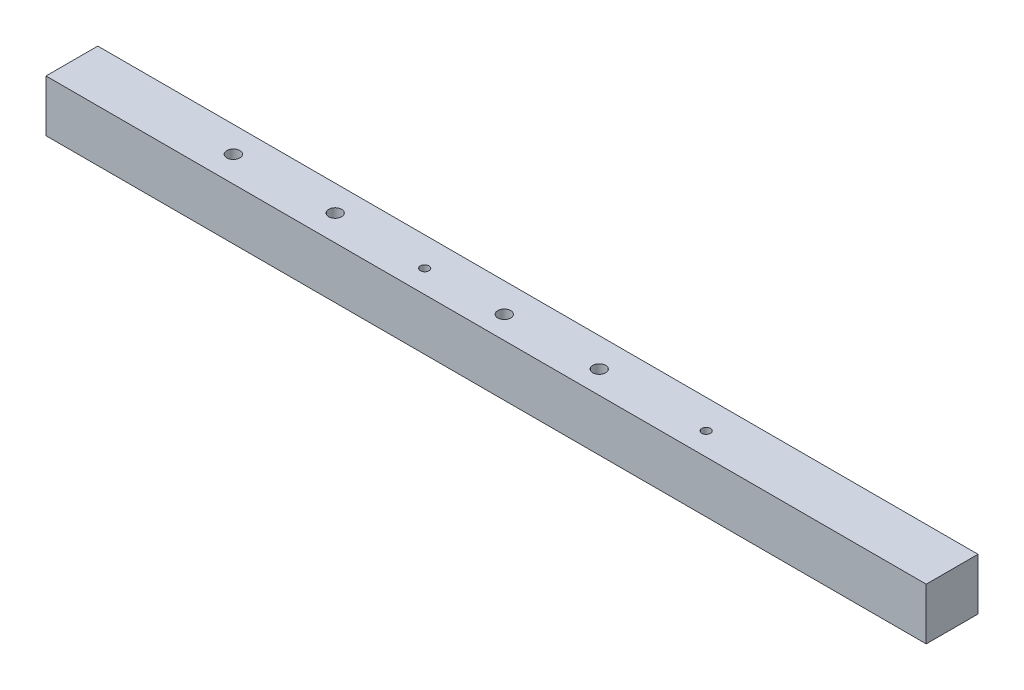
from build123d import *

# Parameters (mm, degrees)
SKETCH1_W           = 647.7
SKETCH1_H           = 38.1
SKETCH1_R           = 4.7625
SKETCH1_R_2         = 3.175
BOSS_EXTRUDE1_DEPTH = 38.1


with BuildPart() as part:
    # Sketch1 → Boss-Extrude1 (new body)
    with BuildSketch(Plane(origin=(0, 0, 0), x_dir=(1, 0, 0), z_dir=(0, 1, 0))):
        with Locations((323.85, 19.05)):
            Rectangle(SKETCH1_W, SKETCH1_H)
        with Locations((118.802175491, 19.05)):
            Circle(SKETCH1_R, mode=Mode.SUBTRACT)
        with Locations((193.732175491, 19.05)):
            Circle(SKETCH1_R, mode=Mode.SUBTRACT)
        with Locations((320.470555491, 16.741576985)):
            Circle(SKETCH1_R, mode=Mode.SUBTRACT)
        with Locations((390.320555491, 16.741576985)):
            Circle(SKETCH1_R, mode=Mode.SUBTRACT)
        with Locations((261.904073055, 16.741576985)):
            Circle(SKETCH1_R_2, mode=Mode.SUBTRACT)
        with Locations((469.041073055, 16.741576985)):
            Circle(SKETCH1_R_2, mode=Mode.SUBTRACT)
    extrude(amount=BOSS_EXTRUDE1_DEPTH)


solid = part.part
